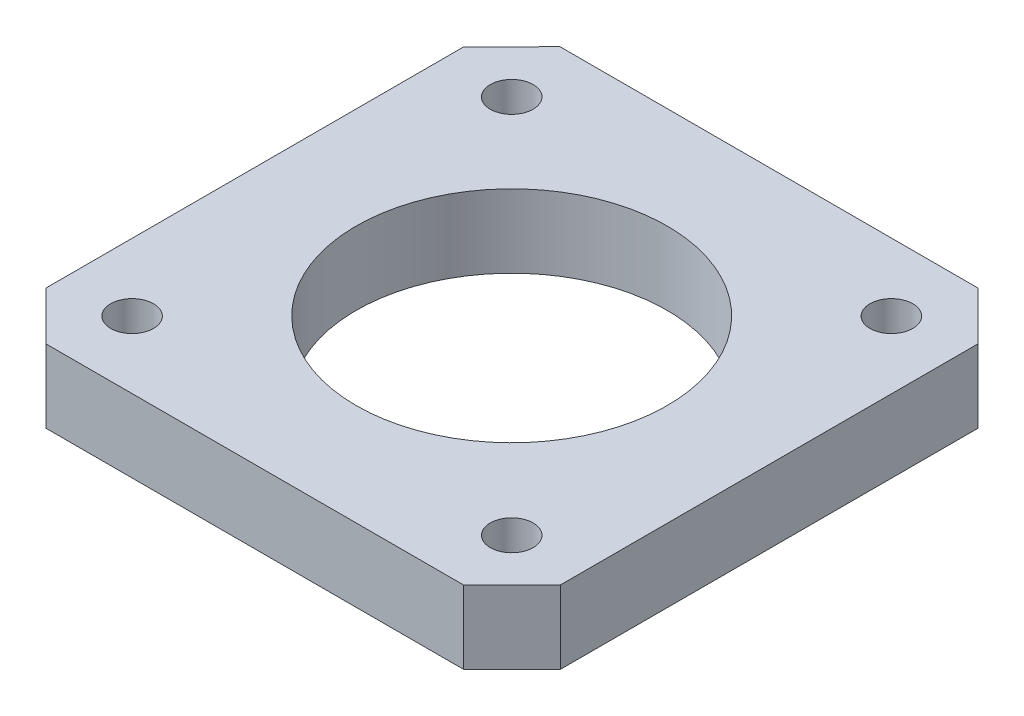
from build123d import *

# Parameters (mm, degrees)
BOSS_EXTRUDE1_DEPTH = 5.969
SKETCH2_R           = 1.75
SKETCH2_R_2         = 1.750000056
CUT_EXTRUDE1_DEPTH  = 5.969
SKETCH3_R           = 12.7
CUT_EXTRUDE2_DEPTH  = 16.51


with BuildPart() as part:
    # Sketch1 → Boss-Extrude1 (new body)
    with BuildSketch(Plane(origin=(0, 0, 0), x_dir=(1, 0, 0), z_dir=(0, 1, 0))):
        Polygon((3.909848904, 42), (0, 38.007654129), (0, 3.951224), (3.951224, 0), (38.048776, 0), (42, 3.951224), (42, 38.054127921), (38.043254173, 42), align=None)
    extrude(amount=BOSS_EXTRUDE1_DEPTH)

    # Sketch2 → Cut-Extrude1 (cut)
    with BuildSketch(Plane(origin=(0, 5.969, 0), x_dir=(1, 0, 0), z_dir=(0, 1, 0))):
        with Locations((5.5, 36.479439065)):
            Circle(SKETCH2_R)
        with Locations((36.5, 36.479439065)):
            Circle(SKETCH2_R_2)
        with Locations((36.5, 5.479439065)):
            Circle(SKETCH2_R_2)
        with Locations((5.5, 5.479439065)):
            Circle(SKETCH2_R_2)
    extrude(amount=-CUT_EXTRUDE1_DEPTH, mode=Mode.SUBTRACT)

    # Sketch3 → Cut-Extrude2 (cut)
    with BuildSketch(Plane(origin=(0, 5.969, 0), x_dir=(1, 0, 0), z_dir=(0, 1, 0))):
        with Locations((20.976551538, 21)):
            Circle(SKETCH3_R)
    extrude(amount=-CUT_EXTRUDE2_DEPTH, mode=Mode.SUBTRACT)


solid = part.part
